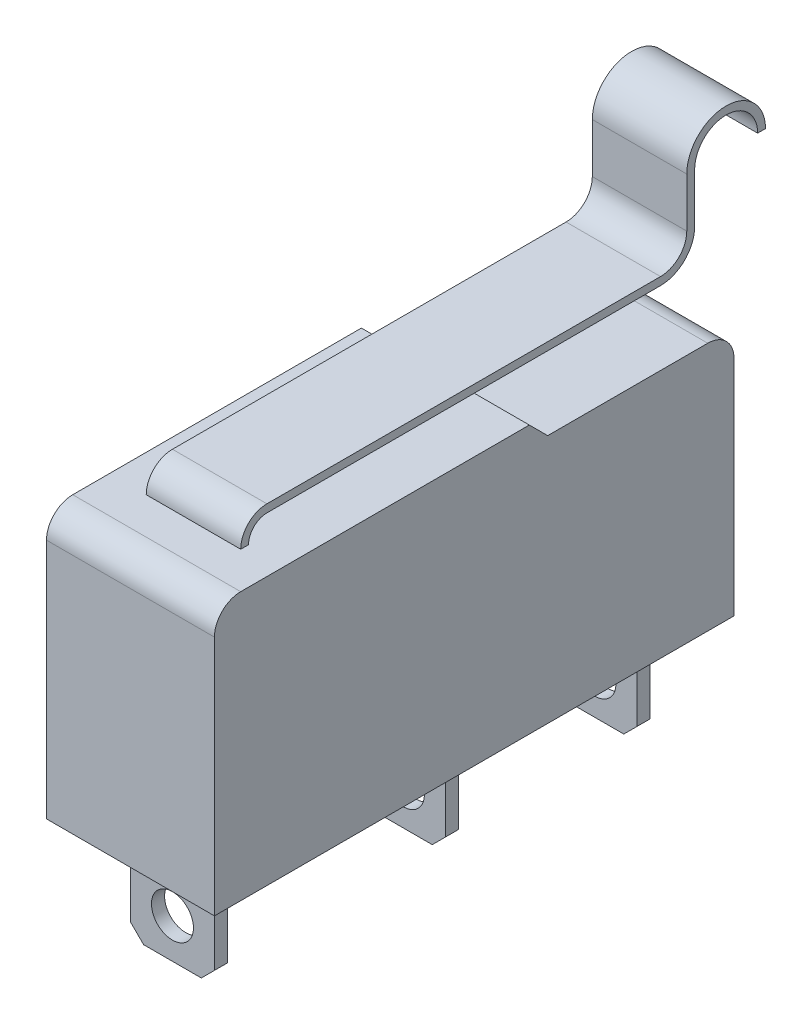
from build123d import *

# Parameters (mm, degrees)
EXTRUDE_1_DEPTH     = 3.2
EXTRUDE_2_DEPTH     = 1.8
SKETCH_3_W          = 0.5
SKETCH_3_H          = 3.9
EXTRUDE_3_DEPTH     = 1.6
CHAMFER_1_SIZE      = 0.5
SKETCH_4_R          = 0.8
CUT_EXTRUDE_1_DEPTH = 25.171981651


with BuildPart() as part:
    # ｽｹｯﾁ1 → ﾎﾞｽ - 押し出し1 (new, symmetric)
    with BuildSketch(Plane(origin=(0, 0, 0), x_dir=(0, 0, -1), z_dir=(1, 0, 0))):
        with BuildLine():
            Line((12, 10.2), (12.7, 9.5))
            Line((12.7, 9.5), (18.8, 9.5))
            ThreePointArc((18.8, 9.5), (19.507106781, 9.207106781), (19.8, 8.5))
            Line((19.8, 8.5), (19.8, 0))
            Line((19.8, 0), (0, 0))
            Line((0, 0), (0, 9.2))
            ThreePointArc((0, 9.2), (0.292893219, 9.907106781), (1, 10.2))
            Line((1, 10.2), (12, 10.2))
        make_face()
    extrude(amount=EXTRUDE_1_DEPTH, both=True)

    # ｽｹｯﾁ2 → ﾎﾞｽ - 押し出し2 (add, symmetric)
    with BuildSketch(Plane(origin=(0, 0, 0), x_dir=(0, 0, -1), z_dir=(1, 0, 0))):
        with BuildLine():
            Line((3.4, 11.2), (18.4, 11.2))
            ThreePointArc((18.4, 11.2), (19.107106781, 11.492893219), (19.4, 12.2))
            Line((19.4, 12.2), (19.4, 14.082191661))
            ThreePointArc((19.4, 14.082191661), (20.9, 15.582191661), (22.4, 14.082191661))
            Line((22.4, 14.082191661), (22.1, 14.082191661))
            ThreePointArc((22.1, 14.082191661), (20.9, 15.282191661), (19.7, 14.082191661))
            Line((19.7, 14.082191661), (19.7, 12.2))
            ThreePointArc((19.7, 12.2), (19.319238816, 11.280761184), (18.4, 10.9))
            Line((18.4, 10.9), (3.4, 10.9))
            ThreePointArc((3.4, 10.9), (2.905025253, 10.694974747), (2.7, 10.2))
            Line((2.7, 10.2), (2.4, 10.2))
            ThreePointArc((2.4, 10.2), (2.692893219, 10.907106781), (3.4, 11.2))
        make_face()
    extrude(amount=EXTRUDE_2_DEPTH, both=True)

    # ｽｹｯﾁ3 → ﾎﾞｽ - 押し出し3 (add, symmetric)
    with BuildSketch(Plane(origin=(0, 0, 0), x_dir=(0, 0, -1), z_dir=(1, 0, 0))):
        with Locations((1.85, -1.95)):
            Rectangle(SKETCH_3_W, SKETCH_3_H)
        with Locations((10.65, -1.95)):
            Rectangle(SKETCH_3_W, SKETCH_3_H)
        with Locations((17.95, -1.95)):
            Rectangle(SKETCH_3_W, SKETCH_3_H)
    extrude(amount=EXTRUDE_3_DEPTH, both=True)

    # 面取り1
    chamfer_1_edges = [part.edges().sort_by_distance(p)[0] for p in [
        (-1.6, -3.9, -17.95),
        (-1.6, -3.9, -10.65),
        (-1.6, -3.9, -1.85),
        (1.6, -3.9, -17.95),
        (1.6, -3.9, -10.65),
        (1.6, -3.9, -1.85),
    ]]
    chamfer(chamfer_1_edges, length=CHAMFER_1_SIZE)

    # ｽｹｯﾁ4 → ｶｯﾄ - 押し出し1 (cut, through all)
    with BuildSketch(Plane(origin=(0, 0, -18.2), x_dir=(-1, 0, 0), z_dir=(0, 0, -1))):
        with Locations((0, -2.4)):
            Circle(SKETCH_4_R)
    extrude(amount=-CUT_EXTRUDE_1_DEPTH, mode=Mode.SUBTRACT)


solid = part.part
